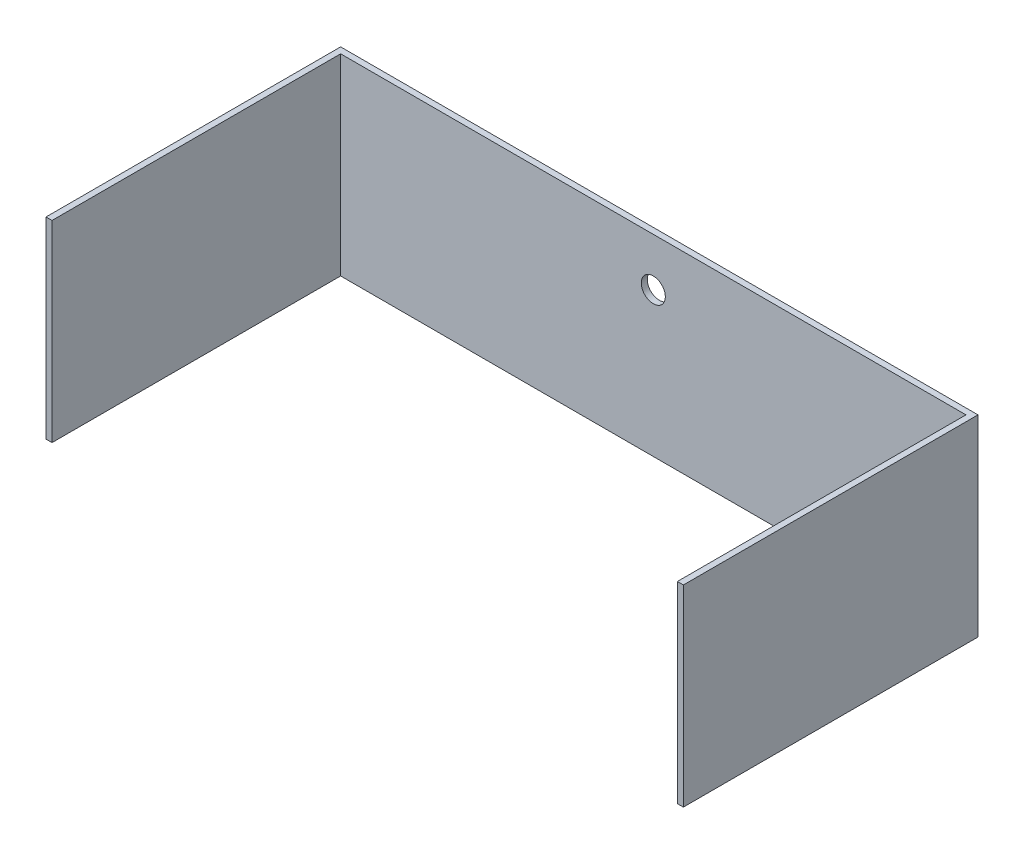
from build123d import *

# Parameters (mm, degrees)
BOSS_EXTRUDE1_DEPTH = 101.6
CUT_EXTRUDE1_REACH  = 383.661
SKETCH2_R           = 6.35


with BuildPart() as part:
    # Sketch1 → Boss-Extrude1 (new body)
    with BuildSketch(Plane(origin=(0, 0, 0), x_dir=(1, 0, 0), z_dir=(0, 1, 0))):
        Polygon((0, 0), (0, 152.4), (330.2, 152.4), (330.2, 0), (333.375, 0), (333.375, 155.575), (-3.175, 155.575), (-3.175, 0), align=None)
    extrude(amount=BOSS_EXTRUDE1_DEPTH)

    # Sketch2 → Cut-Extrude1 (cut, up to next)
    with BuildSketch(Plane(origin=(0, 0, -155.575), x_dir=(-1, 0, 0), z_dir=(0, 0, -1)), mode=Mode.PRIVATE) as cut_extrude1_sk1:
        with Locations((-165.1, 76.2)):
            Circle(SKETCH2_R)
    cut_extrude1_tool1 = extrude(cut_extrude1_sk1.sketch, amount=-CUT_EXTRUDE1_REACH, mode=Mode.PRIVATE) & part.part
    add(cut_extrude1_tool1.solids().sort_by_distance((165.1, 76.2, -155.575))[0], mode=Mode.SUBTRACT)


solid = part.part
